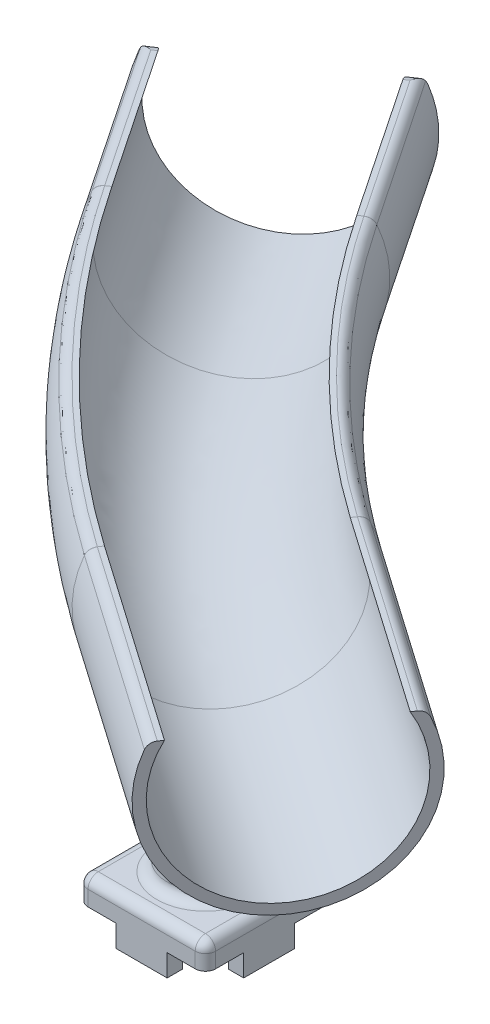
from build123d import *

# Parameters (mm, degrees)
SKETCH8_W           = 25
SKETCH8_H           = 25
BOSS_EXTRUDE1_DEPTH = 5
BOSS_EXTRUDE2_REACH = 209.702
SKETCH9_R           = 7.5
SKETCH9_R_2         = 5.5
SKETCH10_W          = 3
SKETCH10_H          = 10
SKETCH10_W_2        = 10
SKETCH10_H_2        = 3
BOSS_EXTRUDE3_DEPTH = 4.3
SKETCH11_W          = 53.65372901
SKETCH11_H          = 44.189948965
CUT_EXTRUDE1_DEPTH  = 12
FILLET1_R           = 2


with BuildPart() as part:
    # Sweep1: sweep along a path in Sketch5
    with BuildLine(Plane(origin=(0, 0, 0), x_dir=(0.9997397545029943, -0.022809596622636426, -0.00038153401579630816), z_dir=(0.022812787341589733, 0.9995999255318432, 0.016720215621847893))) as sweep1_path:
        Line((0, 0), (25.451825531, -38.458596163))
        ThreePointArc((25.451825531, -38.458596163), (49.581177844, -68.258681915), (78.954049602, -92.90630165))
        Line((78.954049602, -92.90630165), (116.525779391, -118.72877274))
    # Sketch7 → Sweep1 (sweep)
    with BuildSketch(Plane(origin=(0, 0, 0), x_dir=(0, 1, 0), z_dir=(0.5519369853120594, 0, 0.8338858220671675))):
        with BuildLine():
            Line((30, -19.595917942), (30, -17.320508076))
            ThreePointArc((30, -17.320508076), (0, 0), (30, 17.320508076))
            Line((30, 17.320508076), (30, 19.595917942))
            ThreePointArc((30, 19.595917942), (-2, 0), (30, -19.595917942))
        make_face()
    sweep(path=sweep1_path.line)

    # Sketch9 → Boss-Extrude2 (add, up to next)
    with BuildSketch(Plane(origin=(0, -58.13, 0), x_dir=(1, 0, 0), z_dir=(0, 1, 0)), mode=Mode.PRIVATE) as boss_extrude2_sk1:
        with Locations((49.567947352, -68.229885071)):
            Circle(SKETCH9_R)
        with Locations((49.567947352, -68.229885071)):
            Circle(SKETCH9_R_2, mode=Mode.SUBTRACT)
    boss_extrude2_tool1 = extrude(boss_extrude2_sk1.sketch, amount=BOSS_EXTRUDE2_REACH, mode=Mode.PRIVATE) - part.part


with BuildPart() as body_2:
    # Sketch8 → Boss-Extrude1 (new body)
    with BuildSketch(Plane(origin=(0, -63.13, 0), x_dir=(1, 0, 0), z_dir=(0, 1, 0))):
        with Locations((49.567947352, -68.229885071)):
            Rectangle(SKETCH8_W, SKETCH8_H)
    extrude(amount=BOSS_EXTRUDE1_DEPTH)


with BuildPart() as part_1:
    add(part.part)

    add(body_2.part)  # Boss-Extrude2 merges body 2
    add(boss_extrude2_tool1.solids().sort_by_distance((42.280079, -58.13, 68.229885))[0])

    # Sketch10 → Boss-Extrude3 (add)
    with BuildSketch(Plane.XZ.offset(63.13)):
        with Locations((60.567947352, 68.229885071)):
            Rectangle(SKETCH10_W, SKETCH10_H)
        with Locations((38.567947352, 68.229885071)):
            Rectangle(SKETCH10_W, SKETCH10_H)
        with Locations((49.567947352, 57.229885071)):
            Rectangle(SKETCH10_W_2, SKETCH10_H_2)
        with Locations((49.567947352, 79.229885071)):
            Rectangle(SKETCH10_W_2, SKETCH10_H_2)
    extrude(amount=BOSS_EXTRUDE3_DEPTH)

    # Sketch11 → Cut-Extrude1 (cut)
    with BuildSketch(Plane(origin=(0, 0, 0), x_dir=(-0.8338858220671675, 0, 0.5519369853120593), z_dir=(-0.5519369853120593, 0, -0.8338858220671675))):
        with Locations((0, 12.248410397)):
            Rectangle(SKETCH11_W, SKETCH11_H)
    extrude(amount=-CUT_EXTRUDE1_DEPTH, mode=Mode.SUBTRACT)

    # Fillet1
    fillet1_edges = [part_1.edges().sort_by_distance(p)[0] for p in [
        (49.567947352, -58.13, 80.729885071),
        (37.067947352, -58.13, 68.229885071),
        (49.567947352, -58.13, 55.729885071),
        (62.067947352, -58.13, 68.229885071),
        (42.067953398, -3.474377464, 68.239402429),
        (42.067947352, -58.13, 68.229885071),
        (37.067947352, -60.63, 80.729885071),
        (37.067947352, -60.63, 55.729885071),
        (62.067947352, -60.63, 55.729885071),
        (62.067947352, -60.63, 80.729885071),
        (22.015285953, 29.6814649, -0.181140578),
        (-8.768798305, 29.6814649, 20.194400307),
        (-0.306535327, 29.228857808, 35.040780006),
        (63.462424756, 27.829788835, 54.635977511),
        (32.374980958, 29.228857808, 13.409356259),
        (35.507819254, 27.624281731, 82.104100819),
        (86.476127272, 25.790308896, 122.205852673),
        (108.676622906, 26.207873664, 89.910905184),
    ]]
    fillet(fillet1_edges, radius=FILLET1_R)


solid = part_1.part
